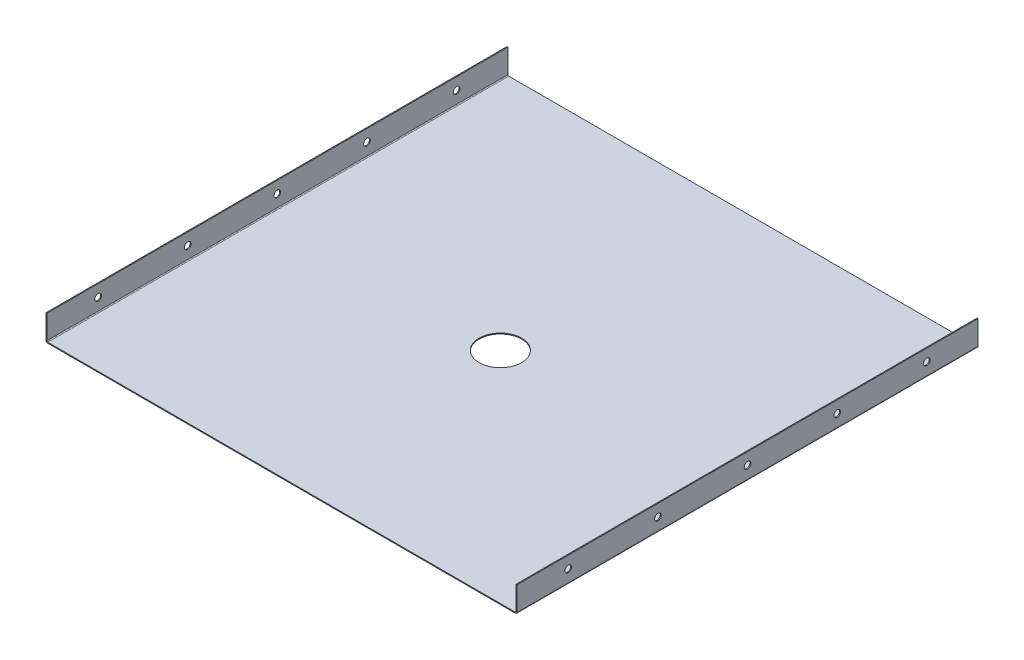
from build123d import *

# Parameters (mm, degrees)
SKETCH1_W                    = 465.4296
SKETCH1_H                    = 457.2
BOSS_EXTRUDE1_DEPTH          = 0.9144
EDGE_FLANGE1_STRIP_W         = 5.4864
EDGE_FLANGE1_STRIP_H         = 0.9144
EDGE_FLANGE1_STRIP_CUT_DEPTH = 457.2
EDGE_FLANGE1_DEPTH           = 457.2
EDGE_FLANGE2_STRIP_W         = 5.4864
EDGE_FLANGE2_STRIP_H         = 0.9144
EDGE_FLANGE2_STRIP_CUT_DEPTH = 457.2
EDGE_FLANGE2_DEPTH           = 457.2
CUT_EXTRUDE1_START           = -233.6292
CUT_EXTRUDE1_OUTLINE_R       = 3.2639
CUT_EXTRUDE1_DEPTH           = 467.2584
CUT_EXTRUDE1_START_2         = -0.9144
CUT_EXTRUDE1_2_OUTLINE_R     = 21.082
CUT_EXTRUDE1_2_DEPTH         = 0.9144


# Read off the part's stored shape, not the designer's step: Cut-Extrude1
# Sheet-metal steps are written as plain solids
with BuildPart() as part:
    # Sketch1 → Boss-Extrude1 (new body)
    with BuildSketch(Plane(origin=(0, 0, 0), x_dir=(1, 0, 0), z_dir=(0, 1, 0))):
        Rectangle(SKETCH1_W, SKETCH1_H)
    extrude(amount=BOSS_EXTRUDE1_DEPTH)

    # Edge-Flange1 strip (across the edge) → Edge-Flange1 strip cut (cut)
    with BuildSketch(Plane(origin=(-232.7148, 0.9144, -228.6), x_dir=(1, 0, 0), z_dir=(0, 0, 1))):
        with Locations((-1.8288, -0.4572)):
            Rectangle(EDGE_FLANGE1_STRIP_W, EDGE_FLANGE1_STRIP_H)
    extrude(amount=EDGE_FLANGE1_STRIP_CUT_DEPTH, mode=Mode.SUBTRACT)

    # Edge-Flange1 section (across the edge) → Edge-Flange1 (add)
    with BuildSketch(Plane(origin=(-232.7148, 0.9144, -228.6), x_dir=(1, 0, 0), z_dir=(0, 0, 1))):
        with BuildLine():
            Line((-0.9144, 0.9144), (-0.9144, 24.4856))
            Line((-0.9144, 24.4856), (0, 24.4856))
            Line((0, 24.4856), (0, 0.9144))
            ThreePointArc((0, 0.9144), (0.267821559, 0.267821559), (0.9144, 0))
            Line((0.9144, 0), (0.9144, -0.9144))
            ThreePointArc((0.9144, -0.9144), (-0.378756881, -0.378756881), (-0.9144, 0.9144))
        make_face()
    extrude(amount=EDGE_FLANGE1_DEPTH)

    # Edge-Flange2 strip (across the edge) → Edge-Flange2 strip cut (cut)
    with BuildSketch(Plane(origin=(232.7148, 0.9144, 228.6), x_dir=(-1, 0, 0), z_dir=(0, 0, -1))):
        with Locations((-1.8288, -0.4572)):
            Rectangle(EDGE_FLANGE2_STRIP_W, EDGE_FLANGE2_STRIP_H)
    extrude(amount=EDGE_FLANGE2_STRIP_CUT_DEPTH, mode=Mode.SUBTRACT)

    # Edge-Flange2 section (across the edge) → Edge-Flange2 (add)
    with BuildSketch(Plane(origin=(232.7148, 0.9144, 228.6), x_dir=(-1, 0, 0), z_dir=(0, 0, -1))):
        with BuildLine():
            Line((-0.9144, 0.9144), (-0.9144, 24.4856))
            Line((-0.9144, 24.4856), (0, 24.4856))
            Line((0, 24.4856), (0, 0.9144))
            ThreePointArc((0, 0.9144), (0.267821559, 0.267821559), (0.9144, 0))
            Line((0.9144, 0), (0.9144, -0.9144))
            ThreePointArc((0.9144, -0.9144), (-0.378756881, -0.378756881), (-0.9144, 0.9144))
        make_face()
    extrude(amount=EDGE_FLANGE2_DEPTH)

    # Cut-Extrude1 outline → Cut-Extrude1 (cut)
    with BuildSketch(Plane.YZ.offset(CUT_EXTRUDE1_START)):
        with Locations((13.6144, -177.8)):
            Circle(CUT_EXTRUDE1_OUTLINE_R)
        with Locations((13.6144, -88.9)):
            Circle(CUT_EXTRUDE1_OUTLINE_R)
        with Locations((13.6144, 0)):
            Circle(CUT_EXTRUDE1_OUTLINE_R)
        with Locations((13.6144, 88.9)):
            Circle(CUT_EXTRUDE1_OUTLINE_R)
        with Locations((13.6144, 177.8)):
            Circle(CUT_EXTRUDE1_OUTLINE_R)
    extrude(amount=CUT_EXTRUDE1_DEPTH, mode=Mode.SUBTRACT)

    # Cut-Extrude1 2 outline → Cut-Extrude1 2 (cut)
    with BuildSketch(Plane(origin=(0, 0.9144, 0), x_dir=(1, 0, 0), z_dir=(0, 1, 0)).offset(CUT_EXTRUDE1_START_2)):
        with Locations((-0.39878, -11.1252)):
            Circle(CUT_EXTRUDE1_2_OUTLINE_R)
    extrude(amount=CUT_EXTRUDE1_2_DEPTH, mode=Mode.SUBTRACT)


solid = part.part
